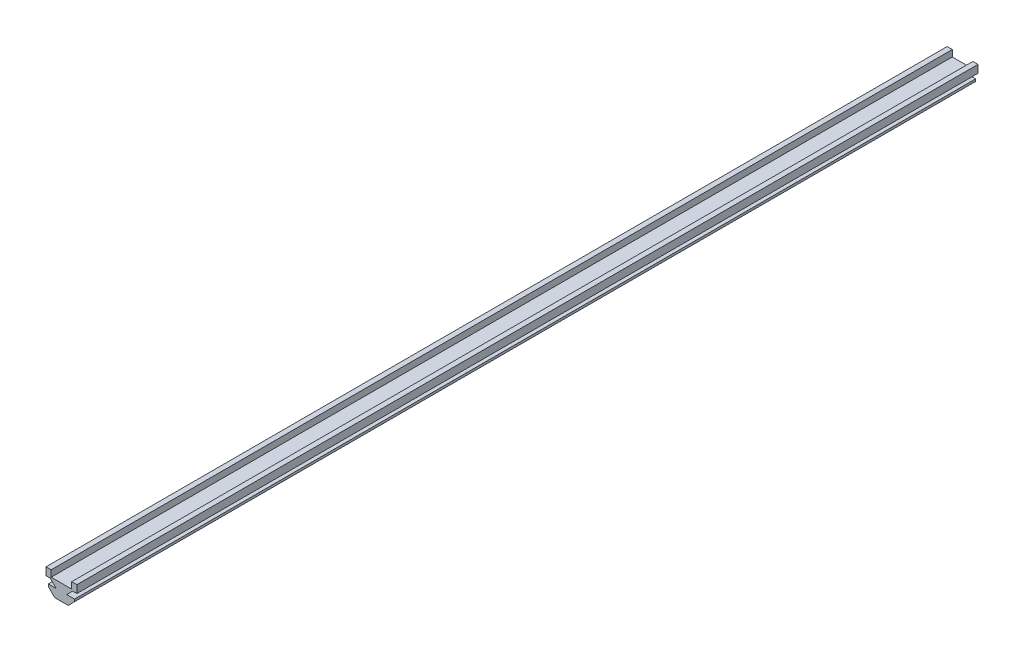
from build123d import *

# Parameters (mm, degrees)
SALIENTE_EXTRUIR1_DEPTH = 350


with BuildPart() as part:
    # Croquis1 → Saliente-Extruir1 (new body)
    with BuildSketch(Plane.XY):
        Polygon((12.627943725, -5.675), (15.1, -3.202943725), (15.1, -2.3), (12.042893219, -2.3), (14.342893219, 0), (16, 0), (16, 3), (14, 3), (14, 0.5), (6, 0.5), (6, 3), (4, 3), (4, 0), (5.657106781, 0), (7.957106781, -2.3), (4.9, -2.3), (4.9, -3.202943725), (7.372056275, -5.675), align=None)
    extrude(amount=SALIENTE_EXTRUIR1_DEPTH)


solid = part.part
